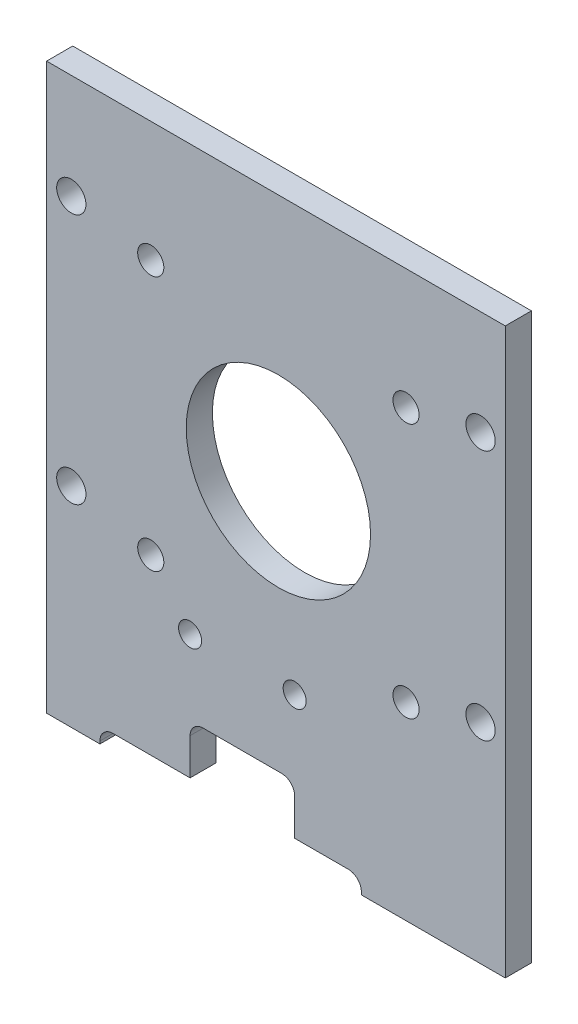
from build123d import *

# Parameters (mm, degrees)
SKETCH1_W           = 55.700676
SKETCH1_H           = 68.58
BOSS_EXTRUDE1_DEPTH = 3.175
SKETCH2_R           = 11.190499971
SKETCH2_R_2         = 1.5875
SKETCH2_R_3         = 1.397
SKETCH2_W           = 12.7
SKETCH2_H           = 7.9375
CUT_EXTRUDE1_DEPTH  = 89.407365824
SKETCH3_W           = 31.75
SKETCH3_H           = 1.905
CUT_EXTRUDE2_DEPTH  = 89.407365824
SKETCH4_R           = 1.778
CUT_EXTRUDE3_DEPTH  = 89.407365824
FILLET1_R           = 1.5875


with BuildPart() as part:
    # Sketch1 → Boss-Extrude1 (new body)
    with BuildSketch(Plane.XY):
        with Locations((27.850338, 34.29)):
            Rectangle(SKETCH1_W, SKETCH1_H)
    extrude(amount=BOSS_EXTRUDE1_DEPTH)

    # Sketch2 → Cut-Extrude1 (cut, through all)
    with BuildSketch(Plane.XY.offset(3.175)):
        with Locations((28.1492, 38.475)):
            Circle(SKETCH2_R)
        with Locations((12.6492, 53.975)):
            Circle(SKETCH2_R_2)
        with Locations((43.6492, 53.975)):
            Circle(SKETCH2_R_2)
        with Locations((43.6492, 22.975)):
            Circle(SKETCH2_R_2)
        with Locations((12.6492, 22.975)):
            Circle(SKETCH2_R_2)
        with Locations((17.4242, 17.005299976)):
            Circle(SKETCH2_R_3)
        with Locations((30.1242, 17.005299976)):
            Circle(SKETCH2_R_3)
        with Locations((23.7742, 3.96875)):
            Rectangle(SKETCH2_W, SKETCH2_H)
    extrude(amount=-CUT_EXTRUDE1_DEPTH, mode=Mode.SUBTRACT)

    # Sketch3 → Cut-Extrude2 (cut, through all)
    with BuildSketch(Plane.XY.offset(3.175)):
        with Locations((22.352, 0.9525)):
            Rectangle(SKETCH3_W, SKETCH3_H)
    extrude(amount=-CUT_EXTRUDE2_DEPTH, mode=Mode.SUBTRACT)

    # Sketch4 → Cut-Extrude3 (cut, through all)
    with BuildSketch(Plane.XY.offset(3.175)):
        with Locations((3, 55.88)):
            Circle(SKETCH4_R)
        with Locations((3, 25.4)):
            Circle(SKETCH4_R)
        with Locations((52.700676, 25.4)):
            Circle(SKETCH4_R)
        with Locations((52.700676, 55.88)):
            Circle(SKETCH4_R)
    extrude(amount=-CUT_EXTRUDE3_DEPTH, mode=Mode.SUBTRACT)

    # Fillet1
    fillet1_edges = [part.edges().sort_by_distance(p)[0] for p in [
        (38.227, 1.905, 1.5875),
        (30.1242, 7.9375, 1.5875),
        (17.4242, 7.9375, 1.5875),
        (6.477, 1.905, 1.5875),
    ]]
    fillet(fillet1_edges, radius=FILLET1_R)


solid = part.part
